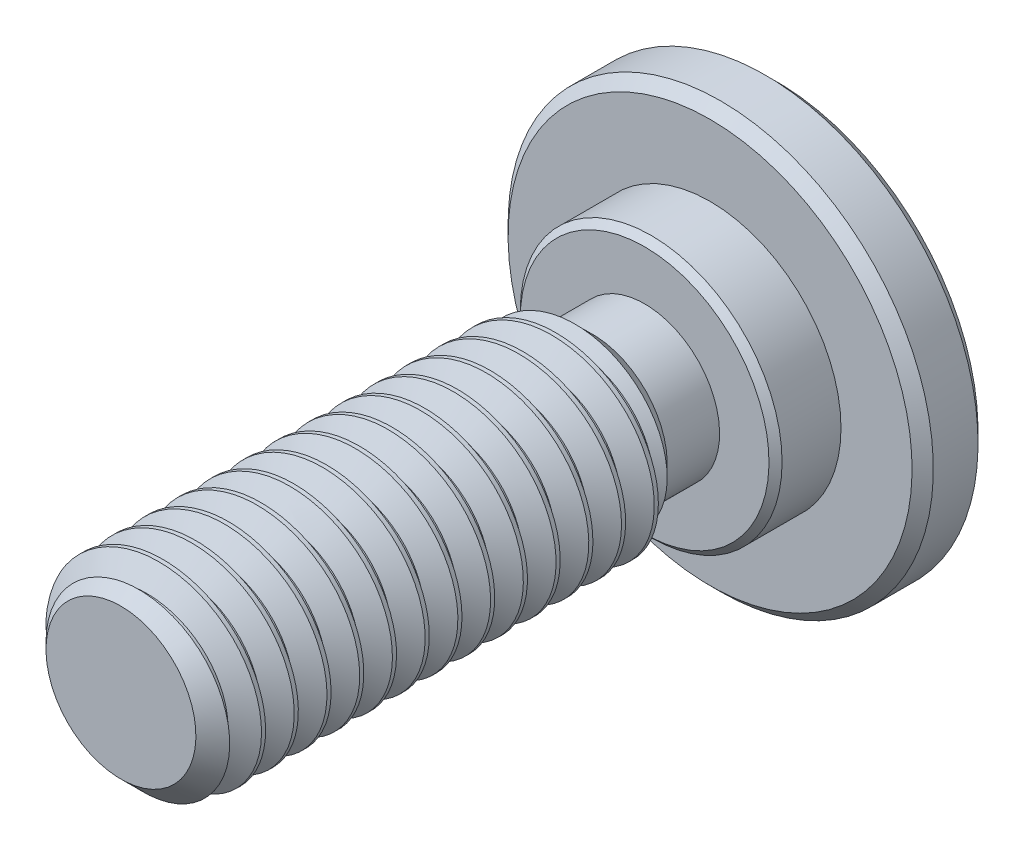
from build123d import *

# Parameters (mm, degrees)
CHAMFER2_SIZE      = 0.5953125
CUT_EXTRUDE1_DEPTH = 1.7859375
CHAMFER1_SIZE      = 0.25781
CHAMFER3_SIZE      = 0.15875
CUT_SWEEP1_PITCH   = 0.79375


with BuildPart() as part:
    # Sketch13 → Revolve1 (revolve)
    with BuildSketch(Plane(origin=(0, 0, 0), x_dir=(0, 0, -1), z_dir=(1, 0, 0)), mode=Mode.PRIVATE) as revolve1_sk:
        Polygon((1.6002, 5.1562), (0, 5.1562), (0, 3.175), (-1.5875, 3.175), (-1.5875, 1.8176875), (-2.8575, 1.8176875), (-3.4528125, 2.413), (-14.2875, 2.413), (-14.2875, 0), (1.6002, 0), align=None)
    revolve(revolve1_sk.sketch.rotate(Axis((0, 0, 14.2875), (0, 0, -1)), 180), axis=Axis((0, 0, 14.2875), (0, 0, -1)))

    # Chamfer2
    chamfer2_edges = [part.edges().sort_by_distance(p)[0] for p in [
        (0, 2.413, 14.2875),
    ]]
    chamfer(chamfer2_edges, length=CHAMFER2_SIZE)

    # Sketch7 → Cut-Extrude1 (cut)
    with BuildSketch(Plane(origin=(0, 0, -1.6002), x_dir=(-1, 0, 0), z_dir=(0, 0, -1))):
        Polygon((0, 1.374815329), (-1.190625, 0.687407664), (-1.190625, -0.687407664), (0, -1.374815329), (1.190625, -0.687407664), (1.190625, 0.687407664), align=None)
    extrude(amount=-CUT_EXTRUDE1_DEPTH, mode=Mode.SUBTRACT)

    # Chamfer1
    chamfer1_edges = [part.edges().sort_by_distance(p)[0] for p in [
        (0, 5.1562, 0),
        (0, 5.1562, -1.6002),
    ]]
    chamfer(chamfer1_edges, length=CHAMFER1_SIZE)

    # Cut-Extrude2 cone 1 section (through the dimple's axis) → Cut-Extrude2 (revolve, cut)
    with BuildSketch(Plane(origin=(0, 0, -1.6002), x_dir=(0, 1, 0), z_dir=(1, 0, 0))):
        Polygon((0, 0), (1.374815329, 0), (0, 1.374815329), align=None)
    revolve(axis=Axis((0, 0, -1.6002), (0, 0, 1)), mode=Mode.SUBTRACT)

    # Chamfer3
    chamfer3_edges = [part.edges().sort_by_distance(p)[0] for p in [
        (0, 3.175, 1.5875),
    ]]
    chamfer(chamfer3_edges, length=CHAMFER3_SIZE)

    # Cut-Sweep1: the profile of Sketch3 screwed along a right-hand helix of 15.68 turns, 6 arcs to a turn; built about Z, then put on its axis
    cut_sweep1_z = Axis((0, 0, 0), (0, 0, 1))
    cut_sweep1_corners = [(2.455962979, 0, -0.719335938), (2.455962979, 0, 0.024804687), (1.897444252, 0, -0.29765625), (1.897444252, 0, -0.396875)]
    with BuildLine(mode=Mode.PRIVATE) as cut_sweep1_profile:
        Line(cut_sweep1_corners[0], cut_sweep1_corners[1])
        Line(cut_sweep1_corners[1], cut_sweep1_corners[2])
        Line(cut_sweep1_corners[2], cut_sweep1_corners[3])
        Line(cut_sweep1_corners[3], cut_sweep1_corners[0])
    cut_sweep1_cap = Face(cut_sweep1_profile.wire())
    cut_sweep1_turn_angles = [0, 30, 60, 90, 120, 150, 180, 210, 240, 270, 300, 330, 360]
    cut_sweep1_turn_weights = [1, 0.8660254037844387, 1, 0.8660254037844387, 1, 0.8660254037844387, 1, 0.8660254037844387, 1, 0.8660254037844387, 1, 0.8660254037844387, 1]
    cut_sweep1_turn_rails = [Edge.make_bspline([Vector(p[0], p[1], 0).rotate(cut_sweep1_z, cut_sweep1_turn_angles[k]) / cut_sweep1_turn_weights[k] + Vector(0, 0, p[2] + CUT_SWEEP1_PITCH * cut_sweep1_turn_angles[k] / 360) for k in range(13)], [0, 0, 0, 1, 1, 2, 2, 3, 3, 4, 4, 5, 5, 6, 6, 6], 2, cut_sweep1_turn_weights) for p in cut_sweep1_corners]
    cut_sweep1_turn_sides = [Face.make_surface_from_curves(cut_sweep1_turn_rails[p[0]], cut_sweep1_turn_rails[p[1]]) for p in [(0, 1), (1, 2), (2, 3), (3, 0)]]
    cut_sweep1_last_angles = [5400, 5430, 5460, 5490, 5520, 5550, 5580, 5610, 5640, 5642.4, 5644.8]
    cut_sweep1_last_weights = [1, 0.8660254037844387, 1, 0.8660254037844387, 1, 0.8660254037844387, 1, 0.8660254037844387, 1, 0.999122830098851, 1]
    cut_sweep1_last_rails = [Edge.make_bspline([Vector(p[0], p[1], 0).rotate(cut_sweep1_z, cut_sweep1_last_angles[k]) / cut_sweep1_last_weights[k] + Vector(0, 0, p[2] + CUT_SWEEP1_PITCH * cut_sweep1_last_angles[k] / 360) for k in range(11)], [0, 0, 0, 1, 1, 2, 2, 3, 3, 4, 4, 5, 5, 5], 2, cut_sweep1_last_weights) for p in cut_sweep1_corners]
    cut_sweep1_last_sides = [Face.make_surface_from_curves(cut_sweep1_last_rails[p[0]], cut_sweep1_last_rails[p[1]]) for p in [(0, 1), (1, 2), (2, 3), (3, 0)]]
    cut_sweep1 = Plane(origin=(0, 0, 14.2875), x_dir=(0, 1, 0), z_dir=(0, 0, -1)) * Solid(Shell([*[p.moved(Location((0, 0, CUT_SWEEP1_PITCH * i))) for i in range(15) for p in cut_sweep1_turn_sides], *cut_sweep1_last_sides, cut_sweep1_cap, cut_sweep1_cap.rotate(cut_sweep1_z, 5644.8).moved(Location((0, 0, CUT_SWEEP1_PITCH * 5644.8 / 360)))]))
    add(cut_sweep1, mode=Mode.SUBTRACT)


solid = part.part
